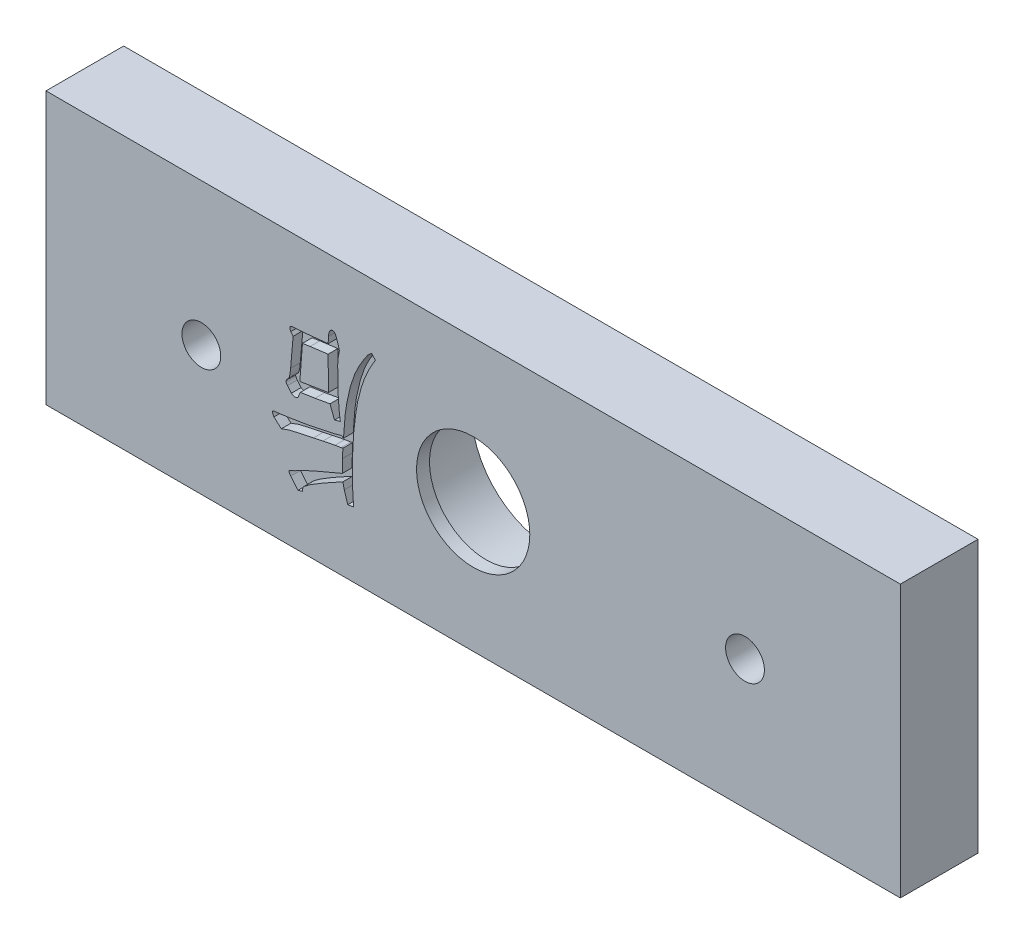
from build123d import *

# Parameters (mm, degrees)
SKETCH_1_W          = 132
SKETCH_1_H          = 42
EXTRUDE_1_DEPTH     = 12
SKETCH_2_R          = 12.25
CUT_EXTRUDE_1_DEPTH = 10
SKETCH_3_R          = 4.1
CUT_EXTRUDE_2_DEPTH = 2
SKETCH_4_R          = 8.75
CUT_EXTRUDE_3_DEPTH = 6
SKETCH_5_R          = 3
CUT_EXTRUDE_4_DEPTH = 10
CUT_EXTRUDE_START   = -1.5
CUT_EXTRUDE_5_DEPTH = 1.5


# Read off the part's stored shape, not the designer's step: 切除-拉伸5
with BuildPart() as part:
    # 草图1 → 凸台-拉伸1 (new body)
    with BuildSketch(Plane.XY):
        with Locations((0, 1)):
            Rectangle(SKETCH_1_W, SKETCH_1_H)
    extrude(amount=EXTRUDE_1_DEPTH)

    # 草图2 → 切除-拉伸1 (cut)
    with BuildSketch(Plane(origin=(0, 0, 0), x_dir=(-1, 0, 0), z_dir=(0, 0, -1))):
        Circle(SKETCH_2_R)
    extrude(amount=-CUT_EXTRUDE_1_DEPTH, mode=Mode.SUBTRACT)

    # 草图3 → 切除-拉伸2 (cut)
    with BuildSketch(Plane(origin=(0, 0, 0), x_dir=(-1, 0, 0), z_dir=(0, 0, -1))):
        with Locations((-42, 0)):
            Circle(SKETCH_3_R)
        with Locations((42, 0)):
            Circle(SKETCH_3_R)
    extrude(amount=-CUT_EXTRUDE_2_DEPTH, mode=Mode.SUBTRACT)

    # 草图4 → 切除-拉伸3 (cut)
    with BuildSketch(Plane(origin=(0, 0, 10), x_dir=(-1, 0, 0), z_dir=(0, 0, -1))):
        Circle(SKETCH_4_R)
    extrude(amount=-CUT_EXTRUDE_3_DEPTH, mode=Mode.SUBTRACT)

    # 草图5 → 切除-拉伸4 (cut)
    with BuildSketch(Plane(origin=(0, 0, 2), x_dir=(-1, 0, 0), z_dir=(0, 0, -1))):
        with Locations((-42, 0)):
            Circle(SKETCH_5_R)
        with Locations((42, 0)):
            Circle(SKETCH_5_R)
    extrude(amount=-CUT_EXTRUDE_4_DEPTH, mode=Mode.SUBTRACT)

    # 切除-拉伸5 outline → 切除-拉伸5 (cut)
    # profile 1 of 2: a face of its own
    with BuildSketch(Plane.XY.offset(12).offset(CUT_EXTRUDE_START)):
        with BuildLine():
            add(Edge.make_bspline(
                [(-15.386028636, 10.926908574), (-15.451235437, 10.823658034), (-15.597790243, 10.591598454), (-15.82021425, 10.19265521), (-16.070174958, 9.708009114), (-16.344072575, 9.157065696), (-16.611657218, 8.565520603), (-16.86361802, 7.967246457), (-17.074526782, 7.369926835), (-17.259042259, 6.784786625), (-17.411321961, 6.216909836), (-17.560561352, 5.68393557), (-17.683989395, 5.180806886), (-17.805603723, 4.697825141), (-17.910640994, 4.195777972), (-18.008946887, 3.642550631), (-18.101047769, 3.020596619), (-18.193268057, 2.358772279), (-18.26902729, 1.712976313), (-18.342115577, 1.140744882), (-18.397350603, 0.667894768), (-18.440430114, 0.266052758), (-18.474361194, -0.121493038), (-18.503962898, -0.551236457), (-18.542166193, -1.052630708), (-18.569883919, -1.603226464), (-18.597035803, -2.15220437), (-18.617091165, -2.651322318), (-18.629577753, -3.075587102), (-18.633871061, -3.453915954), (-18.631614093, -3.840086124), (-18.637955228, -4.290576892), (-18.639790508, -4.831744893), (-18.649212242, -5.430619937), (-18.654904992, -6.021711991), (-18.647563794, -6.541791951), (-18.648299072, -6.958325242), (-18.637472545, -7.201179652), (-18.632847535, -7.30492522)],
                knots=[0, 0, 0, 0, 0.019513704, 0.043857803, 0.072962679, 0.106664143, 0.142173028, 0.176711313, 0.210373531, 0.243369445, 0.274740944, 0.304326305, 0.331818069, 0.35752837, 0.383917789, 0.413770023, 0.447316199, 0.484394245, 0.520558469, 0.551229004, 0.576589019, 0.596640618, 0.615816076, 0.638757779, 0.665483171, 0.696175965, 0.72685799, 0.753327433, 0.776006429, 0.794689574, 0.81379136, 0.83772199, 0.866690294, 0.900278475, 0.933444877, 0.961153757, 0.983405179, 1, 1, 1, 1], degree=3))
            Line((-15.386028636, 10.926908574), (-15.110206642, 11.399746278))
            Line((-15.110206642, 11.399746278), (-15.701253772, 12.022315921))
            Line((-15.701253772, 12.022315921), (-16.27259933, 11.521896018))
            add(Edge.make_bspline(
                [(-20.037298518, -1.504617511), (-20.035378067, -1.46921213), (-20.025600843, -1.285385162), (-20.010843254, -0.966022011), (-19.980629671, -0.563120113), (-19.957635655, -0.187254824), (-19.928855925, 0.18711423), (-19.893026114, 0.591642519), (-19.848489162, 1.039289468), (-19.804495545, 1.513763766), (-19.755846703, 1.976281253), (-19.704561458, 2.388588253), (-19.657047323, 2.734014502), (-19.610911579, 3.040530325), (-19.549017854, 3.366120857), (-19.463698503, 3.764083795), (-19.368696164, 4.267333687), (-19.243283954, 4.86148214), (-19.093112799, 5.529258555), (-18.886955978, 6.243955226), (-18.648283553, 6.99920041), (-18.415287262, 7.652705505), (-18.198598082, 8.198480356), (-18.006286153, 8.630079177), (-17.784075701, 9.076276852), (-17.535197987, 9.537220045), (-17.260568092, 10.013728249), (-16.95321984, 10.50185364), (-16.630155283, 11.012045852), (-16.393527704, 11.349460484), (-16.27259933, 11.521896018)],
                knots=[0.027327266, 0.027327266, 0.027327266, 0.027327266, 0.034839675, 0.06632977, 0.095058871, 0.120437463, 0.146113353, 0.174608335, 0.206479757, 0.241424854, 0.275567385, 0.30501003, 0.329449729, 0.349443429, 0.370675041, 0.39965508, 0.435675057, 0.479173386, 0.528315076, 0.580645299, 0.636707088, 0.696121959, 0.727592374, 0.761103047, 0.796198513, 0.833177494, 0.872078207, 0.912696807, 0.955383759, 1, 1, 1, 1], degree=3))
            add(Edge.make_bspline(
                [(-20.484795208, -1.323528267), (-20.443754455, -1.327084116), (-20.352457825, -1.334994229), (-20.210726229, -1.389266372), (-20.107653428, -1.45555727), (-20.048504035, -1.496725232), (-20.037298518, -1.504617511)],
                knots=[0, 0, 0, 0, 0.18721226, 0.416460397, 0.682502607, 0.744993131, 0.744993131, 0.744993131, 0.744993131], degree=3))
            Line((-20.484795208, -1.323528267), (-20.985215111, -1.481140835))
            Line((-20.985215111, -1.481140835), (-21.477754386, -1.611171204))
            Line((-21.477754386, -1.611171204), (-23.061760693, -1.950038225))
            Line((-23.061760693, -1.950038225), (-24.153227726, -2.182516762))
            Line((-24.153227726, -2.182516762), (-25.552039267, -2.466219385))
            Line((-25.552039267, -2.466219385), (-27.159687459, -2.726280122))
            Line((-27.159687459, -2.726280122), (-28.822500051, -2.990281173))
            Line((-28.822500051, -2.990281173), (-30.382864473, -3.199117826))
            add(Edge.make_bspline(
                [(-30.784776521, -4.022643493), (-30.844274674, -3.92598496), (-30.951343722, -3.752044482), (-31.028671901, -3.508435042), (-30.974115979, -3.327226054), (-30.832044153, -3.2457873), (-30.631490795, -3.205172337), (-30.473939559, -3.201335673), (-30.382864473, -3.199117826)],
                knots=[0, 0, 0, 0, 0.253768289, 0.45666509, 0.543556693, 0.65057697, 0.798010265, 1, 1, 1, 1], degree=3))
            Line((-30.784776521, -4.022643493), (-29.642085404, -5.035304242))
            add(Edge.make_bspline(
                [(-24.677289515, -3.774403698), (-24.941363233, -3.829224688), (-25.43950748, -3.932638085), (-26.139104274, -4.083255603), (-26.748992817, -4.21250536), (-27.267322307, -4.327680717), (-27.69736325, -4.421065579), (-28.036533809, -4.498860021), (-28.284388387, -4.56219303), (-28.501096742, -4.619875935), (-28.724264949, -4.697037817), (-29.001059622, -4.790061329), (-29.311130271, -4.904398926), (-29.527999873, -4.990179084), (-29.642085404, -5.035304242)],
                knots=[0, 0, 0, 0, 0.157694625, 0.297472505, 0.418423781, 0.522212626, 0.607925799, 0.675733146, 0.725650804, 0.75750974, 0.806809198, 0.863638531, 0.928266246, 1, 1, 1, 1], degree=3))
            Line((-24.677289515, -3.774403698), (-23.215432947, -3.459178563))
            Line((-23.215432947, -3.459178563), (-21.343783703, -3.092729342))
            Line((-21.343783703, -3.092729342), (-20.409929238, -2.942997403))
            Line((-20.409929238, -2.942997403), (-20.141987873, -2.891773318))
            Line((-20.141987873, -2.891773318), (-20.169570072, -4.28270423))
            add(Edge.make_bspline(
                [(-20.212913528, -6.292264471), (-20.208621738, -6.163556598), (-20.200476905, -5.919298593), (-20.194306653, -5.572475036), (-20.184476931, -5.263886116), (-20.181988862, -4.993263947), (-20.177580649, -4.760792839), (-20.174462235, -4.567702467), (-20.168759348, -4.412762189), (-20.16932443, -4.32211063), (-20.169570072, -4.28270423)],
                knots=[0, 0, 0, 0, 0.192196752, 0.364745328, 0.517696882, 0.652969928, 0.76864265, 0.864716031, 0.941191808, 1, 1, 1, 1], degree=3))
            add(Edge.make_bspline(
                [(-28.188109465, -10.642371346), (-28.231866605, -10.583002185), (-28.308845562, -10.478558063), (-28.388873351, -10.328617264), (-28.449932463, -10.221169749), (-28.465851258, -10.103258705), (-28.3829967, -9.975047275), (-28.218700261, -9.873400634), (-28.021618532, -9.77328396), (-27.823159442, -9.721263252), (-27.629184412, -9.655286898), (-27.419147994, -9.546417434), (-27.137047706, -9.39831528), (-26.893901315, -9.251051356), (-26.691164371, -9.127684184), (-26.531969577, -9.054124315), (-26.340039968, -8.9507129), (-26.103376995, -8.844866809), (-25.829314529, -8.716594407), (-25.517473207, -8.571733714), (-25.163879065, -8.413388833), (-24.770891577, -8.240611284), (-24.336410725, -8.052550683), (-23.865554777, -7.84180846), (-23.352096702, -7.622614696), (-22.800517584, -7.386058224), (-22.210456598, -7.132846182), (-21.578039122, -6.870881229), (-20.909359278, -6.585708349), (-20.449406694, -6.391909665), (-20.212913528, -6.292264471)],
                knots=[0, 0, 0, 0, 0.022711982, 0.039955643, 0.052467929, 0.060614613, 0.075301257, 0.095892578, 0.120184304, 0.143130158, 0.159025445, 0.18331717, 0.215956798, 0.257386021, 0.271010799, 0.289136933, 0.311432816, 0.338269291, 0.369097045, 0.404822089, 0.444370723, 0.488651946, 0.537296224, 0.590466391, 0.647837826, 0.709573216, 0.775672746, 0.84597902, 0.920807252, 1, 1, 1, 1], degree=3))
            Line((-28.188109465, -10.642371346), (-27.05723929, -11.978137859))
            Line((-27.05723929, -11.978137859), (-26.407087448, -11.785062463))
            add(Edge.make_bspline(
                [(-20.138047558, -7.383731504), (-20.462516462, -7.560954798), (-21.078981122, -7.897664715), (-21.95476506, -8.377830339), (-22.731354237, -8.810717336), (-23.409731162, -9.198070556), (-23.992284562, -9.533629768), (-24.474570961, -9.8271281), (-24.859704869, -10.067836881), (-25.156675099, -10.269595385), (-25.388913298, -10.439152208), (-25.587248439, -10.580492069), (-25.757141432, -10.706044562), (-25.898240579, -10.817796486), (-26.017442608, -10.908342457), (-26.110829933, -10.980410425), (-26.175473772, -11.037826963), (-26.235763553, -11.092457495), (-26.277395471, -11.19030082), (-26.323869599, -11.337439714), (-26.369749834, -11.542141923), (-26.39374107, -11.698230204), (-26.407087448, -11.785062463)],
                knots=[0, 0, 0, 0, 0.141076167, 0.268033302, 0.381115735, 0.480330067, 0.56611908, 0.637632368, 0.695752516, 0.739401652, 0.774591819, 0.805470658, 0.832334348, 0.85519189, 0.874137735, 0.889479229, 0.900134563, 0.907222386, 0.920224243, 0.939718978, 0.966465533, 1, 1, 1, 1], degree=3))
            Line((-20.138047558, -7.383731504), (-19.913449649, -8.345168168))
            Line((-19.913449649, -8.345168168), (-19.381507232, -10.071025787))
            Line((-19.381507232, -10.071025787), (-18.479175281, -9.921293847))
            add(Edge.make_bspline(
                [(-18.632847535, -7.30492522), (-18.631394034, -7.335129483), (-18.627414303, -7.417829716), (-18.625833372, -7.575623107), (-18.612247214, -7.800215448), (-18.59041361, -8.092796236), (-18.574100934, -8.454364062), (-18.544059384, -8.88362901), (-18.513362578, -9.380159423), (-18.491041134, -9.733474926), (-18.479175281, -9.921293847)],
                knots=[0, 0, 0, 0, 0.034609835, 0.094762831, 0.18057268, 0.292074619, 0.430587405, 0.594790682, 0.784594855, 1, 1, 1, 1], degree=3))
        make_face()
    # profile 2 of 2: a face of its own
    with BuildSketch(Plane.XY.offset(12).offset(CUT_EXTRUDE_START)):
        with BuildLine():
            add(Edge.make_bspline(
                [(-27.05723929, 0.477195321), (-27.083602727, 0.445870992), (-27.134861856, 0.384966269), (-27.231552164, 0.313272561), (-27.346603947, 0.280184053), (-27.471113664, 0.267207826), (-27.608789608, 0.285860676), (-27.758377953, 0.330425532), (-27.920901503, 0.402516388), (-28.028548517, 0.466755013), (-28.085661296, 0.500837206)],
                knots=[0, 0, 0, 0, 0.107288827, 0.208604513, 0.309920198, 0.417209025, 0.535141235, 0.671419252, 0.825669482, 1, 1, 1, 1], degree=3))
            Line((-27.05723929, 0.477195321), (-26.698670698, 1.308601617))
            Line((-26.698670698, 1.308601617), (-24.432990034, 1.651408952))
            Line((-24.432990034, 1.651408952), (-22.1200256, 2.065141943))
            Line((-22.1200256, 2.065141943), (-21.422589987, 0.240776469))
            Line((-21.422589987, 0.240776469), (-20.512377407, 0.504777521))
            Line((-20.512377407, 0.504777521), (-20.669989975, 1.462273871))
            add(Edge.make_bspline(
                [(-20.878826628, 4.177150353), (-20.876698338, 4.089129492), (-20.87180312, 3.886675259), (-20.849997947, 3.542565445), (-20.818830302, 3.118275786), (-20.783365571, 2.723141769), (-20.755163022, 2.394578298), (-20.728298505, 2.170537279), (-20.715025956, 1.975674854), (-20.698877427, 1.8129692), (-20.685162371, 1.680458785), (-20.681192654, 1.580204791), (-20.668775681, 1.511099577), (-20.669662824, 1.475428325), (-20.669989975, 1.462273871)],
                knots=[0, 0, 0, 0, 0.096973871, 0.223046794, 0.37972136, 0.565584936, 0.66002196, 0.742940989, 0.81406641, 0.87510388, 0.923042739, 0.960768758, 0.985532732, 1, 1, 1, 1], degree=3))
            Line((-20.878826628, 4.177150353), (-20.930050712, 7.884986013))
            add(Edge.make_bspline(
                [(-20.788199401, 10.363443644), (-20.754482928, 10.258226233), (-20.697011759, 10.078878665), (-20.675558679, 9.815686566), (-20.720310953, 9.572625724), (-20.781585145, 9.293681557), (-20.85520546, 8.941121317), (-20.886215802, 8.603911708), (-20.905400909, 8.325017011), (-20.917920596, 8.143795511), (-20.925881717, 8.001931381), (-20.928833168, 7.919139606), (-20.930050712, 7.884986013)],
                knots=[0, 0, 0, 0, 0.13180555, 0.224668188, 0.31194566, 0.425900723, 0.566645434, 0.741968615, 0.830131604, 0.900953683, 0.959141019, 1, 1, 1, 1], degree=3))
            Line((-20.788199401, 10.363443644), (-20.997036054, 11.017535801))
            Line((-20.997036054, 11.017535801), (-21.229514591, 11.671627958))
            add(Edge.make_bspline(
                [(-22.360384766, 10.95055046), (-22.349114907, 11.081320396), (-22.328655052, 11.318726562), (-22.24018715, 11.632527418), (-22.111390202, 11.873582674), (-21.934589657, 12.024460464), (-21.736821336, 12.096236946), (-21.534891301, 12.047661592), (-21.361899801, 11.894180387), (-21.277513583, 11.752318937), (-21.229514591, 11.671627958)],
                knots=[0, 0, 0, 0, 0.189553544, 0.344124815, 0.469316156, 0.578589755, 0.674177877, 0.761799034, 0.864510976, 1, 1, 1, 1], degree=3))
            Line((-22.360384766, 10.95055046), (-22.403728222, 9.969412224))
            Line((-22.403728222, 9.969412224), (-25.879085345, 9.618724261))
            Line((-25.879085345, 9.618724261), (-27.742853961, 9.488693892))
            add(Edge.make_bspline(
                [(-28.180228837, 8.696690738), (-28.208161841, 8.757734723), (-28.259309275, 8.869510853), (-28.306230383, 9.031369712), (-28.314003372, 9.173124104), (-28.279464361, 9.294217958), (-28.19717518, 9.388502031), (-28.074554174, 9.44418957), (-27.921558684, 9.485600806), (-27.806291333, 9.487595895), (-27.742853961, 9.488693892)],
                knots=[0, 0, 0, 0, 0.166371765, 0.304639222, 0.415431441, 0.514334118, 0.609016884, 0.71536289, 0.84335, 1, 1, 1, 1], degree=3))
            Line((-28.180228837, 8.696690738), (-27.81771993, 8.251435234))
            Line((-27.81771993, 8.251435234), (-28.207811036, 3.779178619))
            add(Edge.make_bspline(
                [(-28.739753453, 2.045440372), (-28.717388057, 2.065092123), (-28.65804553, 2.117234483), (-28.573781647, 2.193775075), (-28.494297051, 2.294615921), (-28.441781022, 2.418383334), (-28.392374507, 2.574346419), (-28.326119003, 2.845551592), (-28.256553363, 3.250081185), (-28.224900394, 3.593673824), (-28.207811036, 3.779178619)],
                knots=[0, 0, 0, 0, 0.047847204, 0.126953887, 0.182671358, 0.252539676, 0.341304097, 0.445723383, 0.700747458, 1, 1, 1, 1], degree=3))
            add(Edge.make_bspline(
                [(-28.68064874, 1.229795333), (-28.716357933, 1.276096812), (-28.780892713, 1.359774304), (-28.846894708, 1.484808941), (-28.905346962, 1.577171713), (-28.928703122, 1.660543499), (-28.924782679, 1.743042071), (-28.881434674, 1.829629451), (-28.825458983, 1.936317839), (-28.770035474, 2.006884508), (-28.739753453, 2.045440372)],
                knots=[0, 0, 0, 0, 0.187307215, 0.338507502, 0.453635032, 0.536504529, 0.612544638, 0.712804079, 0.843083325, 1, 1, 1, 1], degree=3))
            Line((-28.68064874, 1.229795333), (-28.085661296, 0.500837206))
        make_face()
        Polygon((-22.407668537, 8.56666037), (-22.360384766, 3.448192227), (-26.777476982, 2.727114728), (-26.375564934, 8.02289701), (-25.193470675, 8.204151464), align=None, mode=Mode.SUBTRACT)
    extrude(amount=CUT_EXTRUDE_5_DEPTH, mode=Mode.SUBTRACT)


solid = part.part
